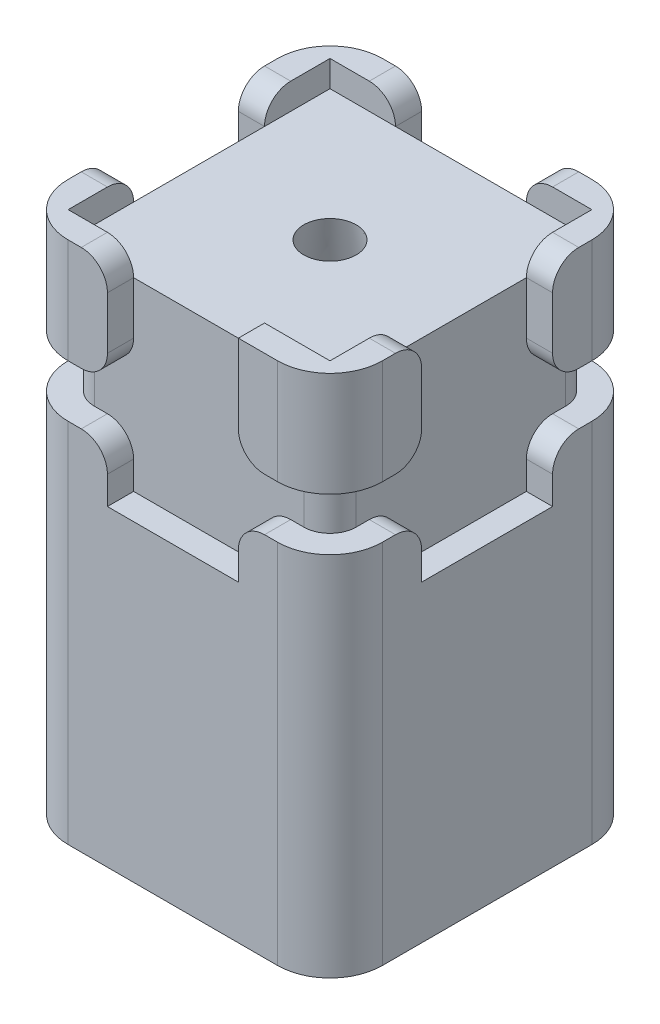
from build123d import *

# Parameters (mm, degrees)
SKETCH2_W           = 30
SKETCH2_H           = 30
BOSS_EXTRUDE1_DEPTH = 50
SKETCH3_W           = 25
SKETCH3_H           = 25
CUT_EXTRUDE1_DEPTH  = 2.5
FILLET1_R           = 5
SKETCH9_W           = 12.5
SKETCH9_H           = 20.172460503
CUT_EXTRUDE2_DEPTH  = 2.5
CIRPATTERN1_COUNT   = 4
SKETCH10_R          = 21.055389581
CUT_EXTRUDE4_DEPTH  = 5
FILLET2_R           = 2.5


with BuildPart() as part:
    # Sketch2 → Boss-Extrude1 (new body)
    with BuildSketch(Plane(origin=(0, 0, 0), x_dir=(1, 0, 0), z_dir=(0, 1, 0))):
        Rectangle(SKETCH2_W, SKETCH2_H)
    extrude(amount=BOSS_EXTRUDE1_DEPTH)

    # Sketch3 → Cut-Extrude1 (cut)
    with BuildSketch(Plane(origin=(0, 50, 0), x_dir=(1, 0, 0), z_dir=(0, 1, 0))):
        Rectangle(SKETCH3_W, SKETCH3_H)
    extrude(amount=-CUT_EXTRUDE1_DEPTH, mode=Mode.SUBTRACT)

    # Fillet1
    fillet1_edges = [part.edges().sort_by_distance(p)[0] for p in [
        (15, 25, 15),
        (-15, 25, 15),
        (-15, 25, -15),
        (15, 25, -15),
    ]]
    fillet(fillet1_edges, radius=FILLET1_R)

    # Cut-Loft2: read off the stored shape, not the designer's step
    # Cut-Loft2: loft between two sections, ruled curve by curve
    cut_loft2_from = [
        Edge.make_bspline([(0, 0, -12.5), (-25, 0, -12.5), (-25, 0, 12.5), (0, 0, 12.5), (25, 0, 12.5), (25, 0, -12.5), (0, 0, -12.5)], [0, 0, 0, 0, 0.5, 0.5, 0.5, 1, 1, 1, 1], 3, [1, 0.333333333, 0.333333333, 1, 0.333333333, 0.333333333, 1]),
    ]
    cut_loft2_to = [
        Edge.make_bspline([(0.784484005, 47.5, -2.373728048), (-3.962972092, 47.5, -3.942696057), (-5.531940101, 47.5, 0.804760039), (-0.784484005, 47.5, 2.373728048), (3.962972092, 47.5, 3.942696057), (5.531940101, 47.5, -0.804760039), (0.784484005, 47.5, -2.373728048)], [0, 0, 0, 0, 0.5, 0.5, 0.5, 1, 1, 1, 1], 3, [1, 0.333333333, 0.333333333, 1, 0.333333333, 0.333333333, 1]),
    ]
    cut_loft2 = Solid(Shell([*[Face.make_surface_from_curves(cut_loft2_from[k], cut_loft2_to[k]) for k in range(1)], Face(Wire(cut_loft2_from)), Face(Wire(cut_loft2_to))]))
    add(cut_loft2, mode=Mode.SUBTRACT)

    # Sketch9 → Cut-Extrude2 (cut)
    with BuildSketch(Plane.XY.offset(15)):
        with Locations((0, 39.913769749)):
            Rectangle(SKETCH9_W, SKETCH9_H)
    cut_extrude2 = extrude(amount=-CUT_EXTRUDE2_DEPTH, mode=Mode.SUBTRACT)

    # CirPattern1: Cut-Loft2, Cut-Extrude2 ×4 about axis
    cirpattern1_axis = Axis((0, 0, 0), (0, 1, 0))
    add([cut_loft2.rotate(cirpattern1_axis, i * 360 / CIRPATTERN1_COUNT) for i in range(1, CIRPATTERN1_COUNT)], mode=Mode.SUBTRACT)
    add([cut_extrude2.rotate(cirpattern1_axis, i * 360 / CIRPATTERN1_COUNT) for i in range(1, CIRPATTERN1_COUNT)], mode=Mode.SUBTRACT)

    # Sketch10 → Cut-Extrude4 (cut)
    with BuildSketch(Plane(origin=(0, 35, 0), x_dir=(1, 0, 0), z_dir=(0, 1, 0))):
        Circle(SKETCH10_R)
        with BuildLine():
            ThreePointArc((12.5, 10), (11.767766953, 11.767766953), (10, 12.5))
            Line((10, 12.5), (6.25, 12.5))
            Line((6.25, 12.5), (-6.25, 12.5))
            Line((-6.25, 12.5), (-10, 12.5))
            ThreePointArc((-10, 12.5), (-11.767766953, 11.767766953), (-12.5, 10))
            Line((-12.5, 10), (-12.5, 6.25))
            Line((-12.5, 6.25), (-12.5, -6.25))
            Line((-12.5, -6.25), (-12.5, -10))
            ThreePointArc((-12.5, -10), (-11.767766953, -11.767766953), (-10, -12.5))
            Line((-10, -12.5), (-6.25, -12.5))
            Line((-6.25, -12.5), (6.25, -12.5))
            Line((6.25, -12.5), (10, -12.5))
            ThreePointArc((10, -12.5), (11.767766953, -11.767766953), (12.5, -10))
            Line((12.5, -10), (12.5, -6.25))
            Line((12.5, -6.25), (12.5, 6.25))
            Line((12.5, 6.25), (12.5, 10))
        make_face(mode=Mode.SUBTRACT)
    extrude(amount=CUT_EXTRUDE4_DEPTH, mode=Mode.SUBTRACT)

    # Fillet2
    fillet2_edges = [part.edges().sort_by_distance(p)[0] for p in [
        (13.75, 50, -6.25),
        (13.75, 50, 6.25),
        (-6.25, 50, -13.75),
        (6.25, 50, -13.75),
        (-13.75, 50, 6.25),
        (-13.75, 50, -6.25),
        (13.75, 35, 6.25),
        (13.75, 40, 6.25),
        (-6.25, 40, 13.75),
        (-13.75, 40, 6.25),
        (-6.25, 40, -13.75),
        (-13.75, 40, -6.25),
        (6.25, 40, -13.75),
        (13.75, 40, -6.25),
        (6.25, 40, 13.75),
        (-6.25, 35, 13.75),
        (6.25, 35, 13.75),
        (13.75, 35, -6.25),
        (6.25, 35, -13.75),
        (-6.25, 35, -13.75),
        (-13.75, 35, -6.25),
        (-13.75, 35, 6.25),
        (-6.25, 50, 13.75),
    ]]
    fillet(fillet2_edges, radius=FILLET2_R)


solid = part.part
